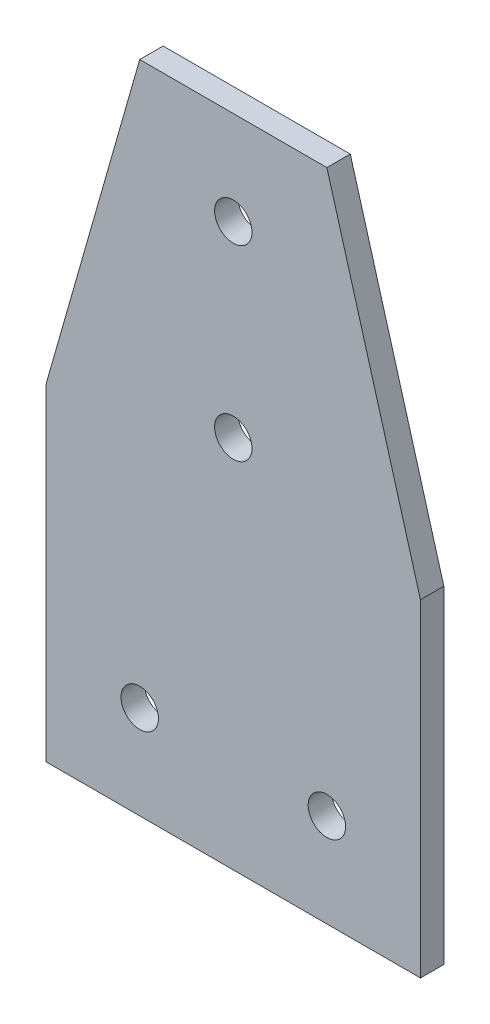
from build123d import *

# Parameters (mm, degrees)
BASE_FLANGE1_OUTLINE_W = 160
BASE_FLANGE1_OUTLINE_H = 10
BASE_FLANGE1_DEPTH     = 280
CUT_EXTRUDE2_DEPTH     = 15
SKETCH16_R             = 8
CUT_EXTRUDE4_DEPTH     = 15


# Read off the part's stored shape, not the designer's step: Base-Flange1
with BuildPart() as part:
    # Base-Flange1 outline → Base-Flange1 (new body)
    with BuildSketch(Plane(origin=(0, 0, 0), x_dir=(1, 0, 0), z_dir=(0, 1, 0))):
        with Locations((80, -5)):
            Rectangle(BASE_FLANGE1_OUTLINE_W, BASE_FLANGE1_OUTLINE_H)
    extrude(amount=BASE_FLANGE1_DEPTH)

    # Sketch12 → Cut-Extrude2 (cut)
    with BuildSketch(Plane.XY.offset(10)):
        Polygon((160, 280), (120, 280), (160, 140), align=None)
        Polygon((0, 280), (40, 280), (0, 140), align=None)
    extrude(amount=-CUT_EXTRUDE2_DEPTH, mode=Mode.SUBTRACT)

    # Sketch16 → Cut-Extrude4 (cut)
    with BuildSketch(Plane.XY.offset(10)):
        with Locations((80, 240)):
            Circle(SKETCH16_R)
        with Locations((80, 160)):
            Circle(SKETCH16_R)
        with Locations((40, 40)):
            Circle(SKETCH16_R)
        with Locations((120, 40)):
            Circle(SKETCH16_R)
    extrude(amount=-CUT_EXTRUDE4_DEPTH, mode=Mode.SUBTRACT)


solid = part.part
